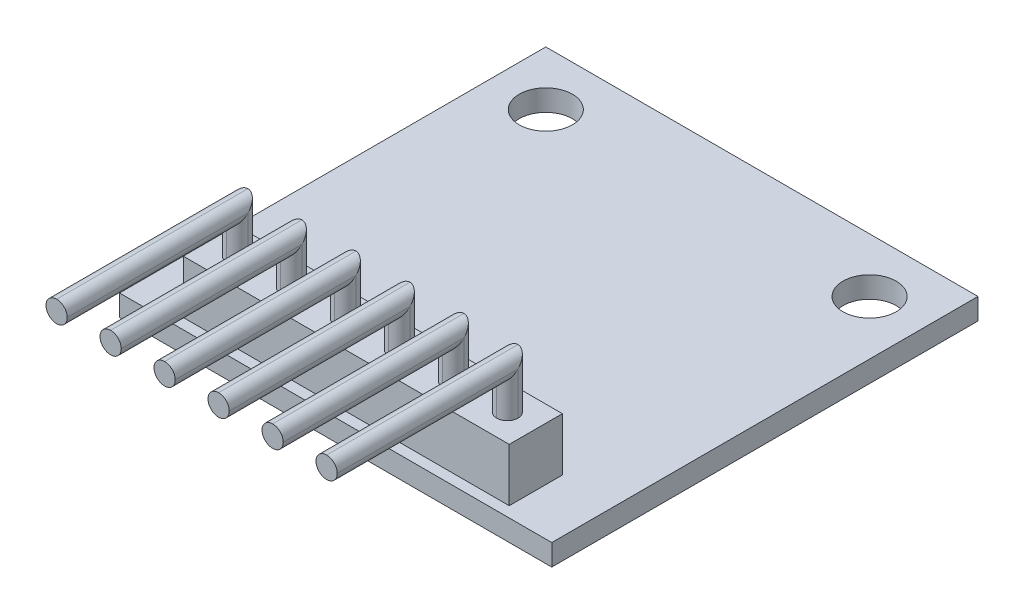
from build123d import *

# Parameters (mm, degrees)
SKETCH1_W              = 20.33
SKETCH1_H              = 20.05
SKETCH1_R              = 1.25
BOSS_EXTRUDE1_DEPTH    = 1
SKETCH2_W              = 8
SKETCH2_H              = 4
BOSS_EXTRUDE2_DEPTH    = 1
SKETCH3_W              = 15.33
SKETCH3_H              = 2.5
BOSS_EXTRUDE3_DEPTH    = 2.5
SKETCH4_W              = 1
SKETCH4_H              = 1
BOSS_EXTRUDE4_DEPTH    = 2.5
SKETCH5_W              = 1
SKETCH5_H              = 1
BOSS_EXTRUDE5_DEPTH    = 8
FILLET1_R              = 0.5
LPATTERN4_COUNT        = 6
LPATTERN4_PITCH        = 2.54
FILLET1_OF_LPATTERN4_R = 0.5


with BuildPart() as part:
    # Sketch1 → Boss-Extrude1 (new body)
    with BuildSketch(Plane(origin=(0, 0, 0), x_dir=(1, 0, 0), z_dir=(0, 1, 0))):
        Rectangle(SKETCH1_W, SKETCH1_H)
        with Locations(Location((-7.615, 7.475, 0), (0, 0, 270))):
            Circle(SKETCH1_R, mode=Mode.SUBTRACT)
        with Locations(Location((7.615, 7.475, 0), (0, 0, 90))):
            Circle(SKETCH1_R, mode=Mode.SUBTRACT)
    extrude(amount=BOSS_EXTRUDE1_DEPTH)

    # Sketch2 → Boss-Extrude2 (add)
    with BuildSketch(Plane.XZ):
        with Locations((0, 3.975)):
            Rectangle(SKETCH2_W, SKETCH2_H)
    extrude(amount=BOSS_EXTRUDE2_DEPTH)

    # Sketch3 → Boss-Extrude3 (add)
    with BuildSketch(Plane(origin=(0, 1, 0), x_dir=(1, 0, 0), z_dir=(0, 1, 0))):
        with Locations((0, -8.275)):
            Rectangle(SKETCH3_W, SKETCH3_H)
    extrude(amount=BOSS_EXTRUDE3_DEPTH)

    # Sketch4 → Boss-Extrude4 (add)
    with BuildSketch(Plane(origin=(0, 3.5, 0), x_dir=(1, 0, 0), z_dir=(0, 1, 0))):
        with Locations((-6.395, -8.255)):
            Rectangle(SKETCH4_W, SKETCH4_H)
    boss_extrude4 = extrude(amount=BOSS_EXTRUDE4_DEPTH)

    # Sketch5 → Boss-Extrude5 (add)
    with BuildSketch(Plane.XY.offset(8.755)):
        with Locations((-6.395, 5.5)):
            Rectangle(SKETCH5_W, SKETCH5_H)
    boss_extrude5 = extrude(amount=BOSS_EXTRUDE5_DEPTH)

    # Fillet1
    fillet1_edges = [part.edges().sort_by_distance(p)[0] for p in [
        (-5.895, 5, 12.755),
        (-6.895, 5, 12.755),
        (-5.895, 4.25, 8.755),
        (-6.895, 4.25, 8.755),
        (-5.895, 4.75, 7.755),
        (-6.895, 4.75, 7.755),
        (-5.895, 6, 12.255),
        (-6.895, 6, 12.255),
    ]]
    fillet(fillet1_edges, radius=FILLET1_R - 0.0001)  # a hair under: the kernel refuses the full size

    # LPattern4: Boss-Extrude4, Boss-Extrude5 ×6
    with Locations(*[(i * LPATTERN4_PITCH, 0, 0) for i in range(1, LPATTERN4_COUNT)]):
        add(boss_extrude4)
        add(boss_extrude5)

    # Fillet1 of LPattern4
    fillet1_of_lpattern4_edges = [part.edges().sort_by_distance(p)[0] for p in [
        (-3.355, 5, 12.755),
        (-4.355, 5, 12.755),
        (-3.355, 4.25, 8.755),
        (-4.355, 4.25, 8.755),
        (-3.355, 4.75, 7.755),
        (-4.355, 4.75, 7.755),
        (-3.355, 6, 12.255),
        (-4.355, 6, 12.255),
        (-0.815, 5, 12.755),
        (-1.815, 5, 12.755),
        (-0.815, 4.25, 8.755),
        (-1.815, 4.25, 8.755),
        (-0.815, 4.75, 7.755),
        (-1.815, 4.75, 7.755),
        (-0.815, 6, 12.255),
        (-1.815, 6, 12.255),
        (1.725, 5, 12.755),
        (0.725, 5, 12.755),
        (1.725, 4.25, 8.755),
        (0.725, 4.25, 8.755),
        (1.725, 4.75, 7.755),
        (0.725, 4.75, 7.755),
        (1.725, 6, 12.255),
        (0.725, 6, 12.255),
        (4.265, 5, 12.755),
        (3.265, 5, 12.755),
        (4.265, 4.25, 8.755),
        (3.265, 4.25, 8.755),
        (4.265, 4.75, 7.755),
        (3.265, 4.75, 7.755),
        (4.265, 6, 12.255),
        (3.265, 6, 12.255),
        (6.805, 5, 12.755),
        (5.805, 5, 12.755),
        (6.805, 4.25, 8.755),
        (5.805, 4.25, 8.755),
        (6.805, 4.75, 7.755),
        (5.805, 4.75, 7.755),
        (6.805, 6, 12.255),
        (5.805, 6, 12.255),
    ]]
    fillet(fillet1_of_lpattern4_edges, radius=FILLET1_OF_LPATTERN4_R - 0.0001)  # a hair under: the kernel refuses the full size


solid = part.part
